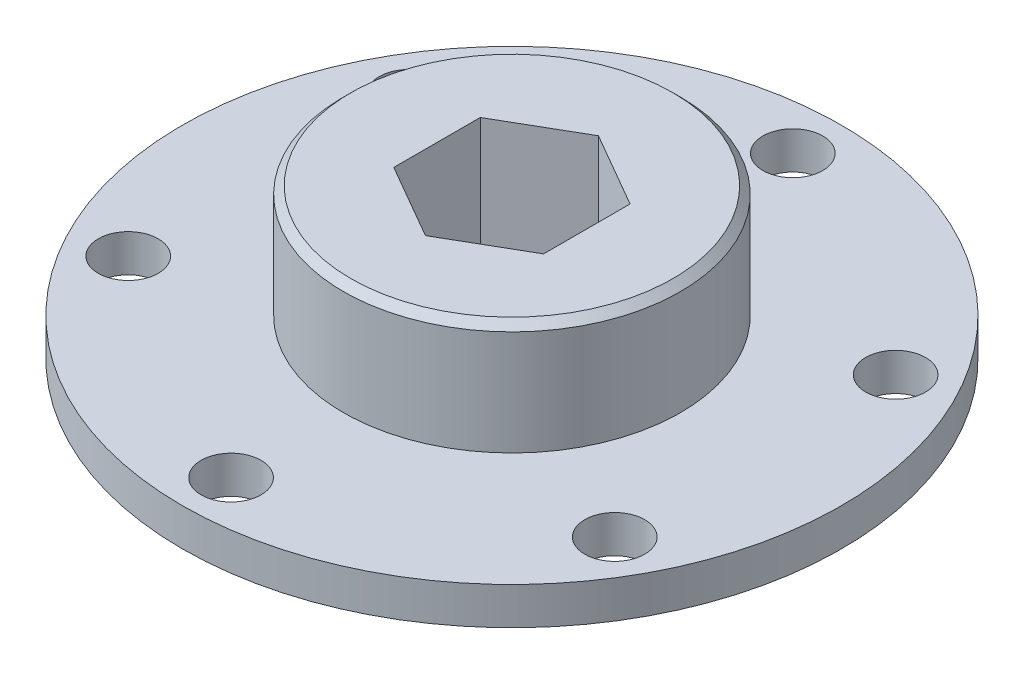
from build123d import *

# Parameters (mm, degrees)
SKETCH1_R               = 27.94
BOSS_EXTRUDE1_DEPTH     = 3.175
SKETCH2_R               = 14.2875
BOSS_EXTRUDE2_DEPTH     = 9.525
CHAMFER1_SIZE           = 0.635
CUT_EXTRUDE2_DEPTH      = 42.503941981
CUT_EXTRUDE2_DEPTH_BACK = 42.503941981
SKETCH4_R               = 2.54
CUT_EXTRUDE3_DEPTH      = 42.503941981


with BuildPart() as part:
    # Sketch1 → Boss-Extrude1 (new body)
    with BuildSketch(Plane(origin=(0, 0, 0), x_dir=(1, 0, 0), z_dir=(0, 1, 0))):
        Circle(SKETCH1_R)
    extrude(amount=BOSS_EXTRUDE1_DEPTH)

    # Sketch2 → Boss-Extrude2 (add)
    with BuildSketch(Plane(origin=(0, 3.175, 0), x_dir=(1, 0, 0), z_dir=(0, 1, 0))):
        Circle(SKETCH2_R)
    extrude(amount=BOSS_EXTRUDE2_DEPTH)

    # Chamfer1
    chamfer1_edges = [part.edges().sort_by_distance(p)[0] for p in [
        (-14.2875, 12.7, 0),
    ]]
    chamfer(chamfer1_edges, length=CHAMFER1_SIZE)

    # Sketch3 → Cut-Extrude2 (cut, two sides: drawn at the far end of the back side and taken through both)
    with BuildSketch(Plane(origin=(0, 12.7, 0), x_dir=(1, 0, 0), z_dir=(0, 1, 0)).offset(-CUT_EXTRUDE2_DEPTH_BACK)):
        Polygon((6.35, 3.666174209), (0, 7.332348419), (-6.35, 3.666174209), (-6.35, -3.666174209), (0, -7.332348419), (6.35, -3.666174209), align=None)
    extrude(amount=CUT_EXTRUDE2_DEPTH + CUT_EXTRUDE2_DEPTH_BACK, mode=Mode.SUBTRACT)

    # Sketch4 → Cut-Extrude3 (cut, through all)
    with BuildSketch(Plane.XZ):
        with Locations((0, 23.8125)):
            Circle(SKETCH4_R)
        with Locations((20.622229928, 11.90625)):
            Circle(SKETCH4_R)
        with Locations((20.622229928, -11.90625)):
            Circle(SKETCH4_R)
        with Locations((0, -23.8125)):
            Circle(SKETCH4_R)
        with Locations((-20.622229928, -11.90625)):
            Circle(SKETCH4_R)
        with Locations((-20.622229928, 11.90625)):
            Circle(SKETCH4_R)
    extrude(amount=-CUT_EXTRUDE3_DEPTH, mode=Mode.SUBTRACT)


solid = part.part
